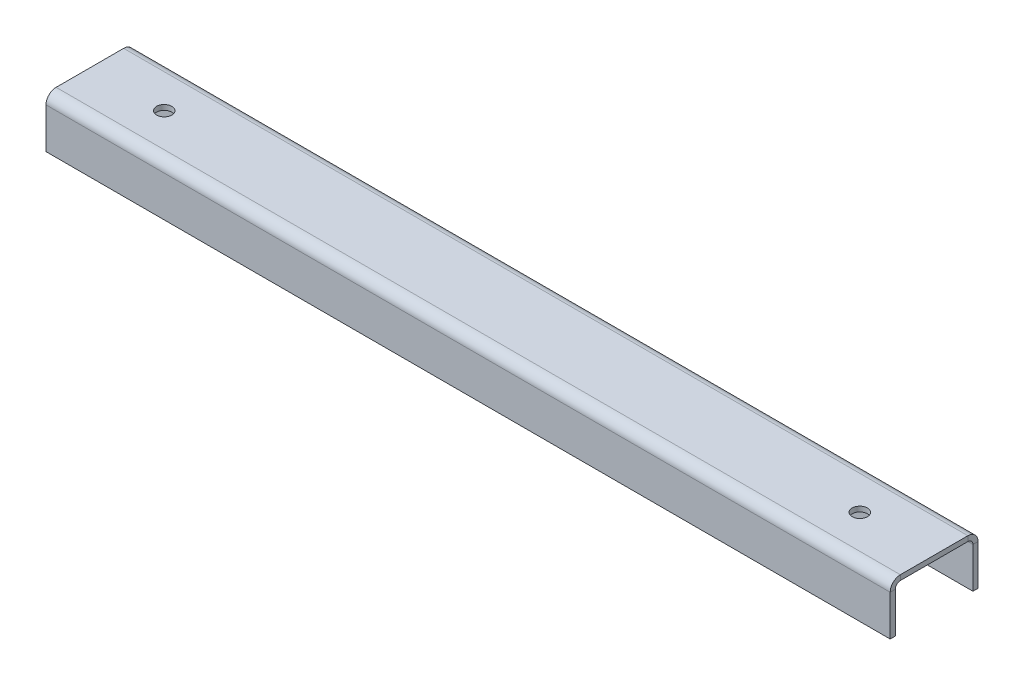
from build123d import *

# Parameters (mm, degrees)
SKETCH1_W               = 500
SKETCH1_H               = 40
SKETCH1_R               = 4.5
BASE_FLANGE1_DEPTH      = 3
EDGE_FLANGE1_DEPTH      = 500
EDGE_FLANGE1_BEND_DEPTH = 500


# Sheet-metal steps are written as plain solids
with BuildPart() as part:
    # Sketch1 → Base-Flange1 (new body)
    with BuildSketch(Plane(origin=(448.080425635, -33993.063627841, -9815.329913798), x_dir=(1, 0, 0), z_dir=(0, 1, 0))):
        with Locations((0.368301387, -1705.033559341)):
            Rectangle(SKETCH1_W, SKETCH1_H)
        with Locations(Location((-205.631698613, -1705.033559341, 0), (0, 0, 270))):
            Circle(SKETCH1_R, mode=Mode.SUBTRACT)
        with Locations(Location((206.368301387, -1705.033559341, 0), (0, 0, 270))):
            Circle(SKETCH1_R, mode=Mode.SUBTRACT)
    extrude(amount=-BASE_FLANGE1_DEPTH)

    # Edge-Flange1 section (across the edge) → Edge-Flange1 (add)
    with BuildSketch(Plane(origin=(698.448727021, -33996.063627841, -8087.296354457), x_dir=(0, 0, -1), z_dir=(-1, 0, 0))):
        with BuildLine():
            Line((-3, 3), (-3, 27))
            Line((-3, 27), (0, 27))
            Line((0, 27), (0, 3))
            ThreePointArc((0, 3), (0.878679656, 0.878679656), (3, 0))
            Line((3, 0), (3, -3))
            ThreePointArc((3, -3), (-1.242640687, -1.242640687), (-3, 3))
        make_face()
    extrude(amount=EDGE_FLANGE1_DEPTH)

    # Edge-Flange1 section 2 (across the edge) → Edge-Flange1 bend (add)
    with BuildSketch(Plane(origin=(198.448727021, -33996.063627841, -8133.296354457), x_dir=(0, 0, 1), z_dir=(1, 0, 0))):
        with BuildLine():
            Line((-3, 3), (-3, 27))
            Line((-3, 27), (0, 27))
            Line((0, 27), (0, 3))
            ThreePointArc((0, 3), (0.878679656, 0.878679656), (3, 0))
            Line((3, 0), (3, -3))
            ThreePointArc((3, -3), (-1.242640687, -1.242640687), (-3, 3))
        make_face()
    extrude(amount=EDGE_FLANGE1_BEND_DEPTH)


solid = part.part
